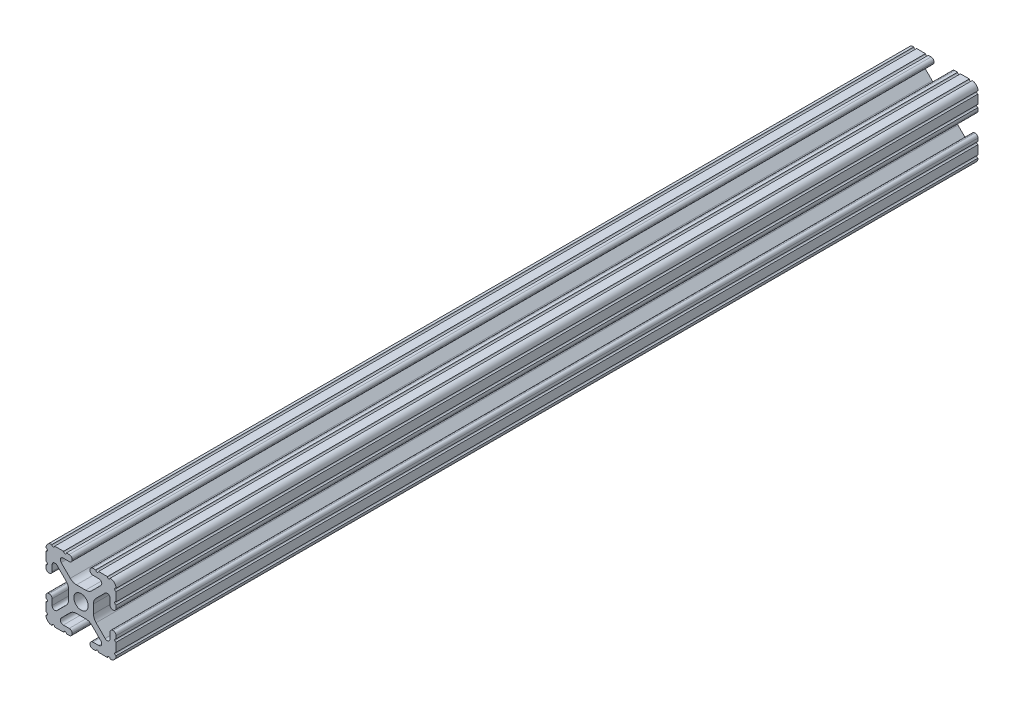
from build123d import *

# Parameters (mm, degrees)
SKETCH1_R               = 2.6035
BOSS_EXTRUDE1_DEPTH     = 457.2
CUT_EXTRUDE2_DEPTH      = 4.318
CUT_EXTRUDE2_DEPTH_BACK = 26.924
CUT_EXTRUDE3_DEPTH      = 459.081095441
CUT_EXTRUDE3_DEPTH_BACK = 459.081095441
SKETCH4_W               = 350.778797989
SKETCH4_H               = 30.197320423


with BuildPart() as part:
    # Sketch1 → Boss-Extrude1 (new, symmetric)
    with BuildSketch(Plane.XY):
        with BuildLine():
            Line((-7.179650497, -8.645192506), (-3.952270251, -5.423690499))
            ThreePointArc((-3.952270251, -5.423690499), (-2.922936451, -4.736929036), (-1.709253557, -4.4958))
            Line((-1.709253557, -4.4958), (1.709253557, -4.4958))
            ThreePointArc((1.709253557, -4.4958), (2.922936451, -4.736929036), (3.952270251, -5.423690499))
            Line((3.952270251, -5.423690499), (7.179650497, -8.645192506))
            ThreePointArc((7.179650497, -8.645192506), (7.41473083, -9.822813117), (6.416408329, -10.4902))
            Line((6.416408329, -10.4902), (4.287512407, -10.4902))
            ThreePointArc((4.287512407, -10.4902), (3.54574862, -10.79744862), (3.2385, -11.539212407))
            Line((3.2385, -11.539212407), (3.2385, -11.650987593))
            ThreePointArc((3.2385, -11.650987593), (3.54574862, -12.39275138), (4.287512407, -12.7))
            Line((4.287512407, -12.7), (5.317126718, -12.7))
            ThreePointArc((5.317126718, -12.7), (5.825126718, -12.192), (6.333126718, -12.7))
            Line((6.333126718, -12.7), (9.550443118, -12.7))
            ThreePointArc((9.550443118, -12.7), (10.058366869, -12.192000006), (10.566443095, -12.699847501))
            ThreePointArc((10.566443095, -12.699847501), (12.082537762, -12.08250727), (12.699846982, -10.566399977))
            ThreePointArc((12.699846982, -10.566399977), (12.192000006, -10.058323491), (12.7, -9.5504))
            Line((12.7, -9.5504), (12.7, -6.3330836))
            ThreePointArc((12.7, -6.3330836), (12.192, -5.8250836), (12.7, -5.3170836))
            Line((12.7, -5.3170836), (12.7, -4.287469289))
            ThreePointArc((12.7, -4.287469289), (12.39275138, -3.545705502), (11.650987593, -3.238456882))
            Line((11.650987593, -3.238456882), (11.539212407, -3.238456882))
            ThreePointArc((11.539212407, -3.238456882), (10.79744862, -3.545705502), (10.4902, -4.287469289))
            Line((10.4902, -4.287469289), (10.4902, -6.402089023))
            ThreePointArc((10.4902, -6.402089023), (9.856505071, -7.351067942), (8.737131347, -7.129408934))
            Line((8.737131347, -7.129408934), (5.441005833, -3.840816462))
            ThreePointArc((5.441005833, -3.840816462), (4.750877967, -2.809883091), (4.5085, -1.593185507))
            Line((4.5085, -1.593185507), (4.5085, 1.593185507))
            ThreePointArc((4.5085, 1.593185507), (4.750877967, 2.809883091), (5.441005833, 3.840816462))
            Line((5.441005833, 3.840816462), (8.737131347, 7.129408934))
            ThreePointArc((8.737131347, 7.129408934), (9.856505071, 7.351067942), (10.4902, 6.402089023))
            Line((10.4902, 6.402089023), (10.4902, 4.287469289))
            ThreePointArc((10.4902, 4.287469289), (10.79744862, 3.545705502), (11.539212407, 3.238456882))
            Line((11.539212407, 3.238456882), (11.650987593, 3.238456882))
            ThreePointArc((11.650987593, 3.238456882), (12.39275138, 3.545705502), (12.7, 4.287469289))
            Line((12.7, 4.287469289), (12.7, 5.3170836))
            ThreePointArc((12.7, 5.3170836), (12.192, 5.8250836), (12.7, 6.3330836))
            Line((12.7, 6.3330836), (12.7, 9.5504))
            ThreePointArc((12.7, 9.5504), (12.192000006, 10.058323491), (12.699846982, 10.566399977))
            ThreePointArc((12.699846982, 10.566399977), (12.082537762, 12.08250727), (10.566443095, 12.699847501))
            ThreePointArc((10.566443095, 12.699847501), (10.058366869, 12.192000006), (9.550443118, 12.7))
            Line((9.550443118, 12.7), (6.333126718, 12.7))
            ThreePointArc((6.333126718, 12.7), (5.825126718, 12.192), (5.317126718, 12.7))
            Line((5.317126718, 12.7), (4.287512407, 12.7))
            ThreePointArc((4.287512407, 12.7), (3.54574862, 12.39275138), (3.2385, 11.650987593))
            Line((3.2385, 11.650987593), (3.2385, 11.539212407))
            ThreePointArc((3.2385, 11.539212407), (3.54574862, 10.79744862), (4.287512407, 10.4902))
            Line((4.287512407, 10.4902), (6.476788598, 10.4902))
            ThreePointArc((6.476788598, 10.4902), (7.432222385, 9.85140422), (7.207036008, 8.724370562))
            Line((7.207036008, 8.724370562), (3.898272566, 5.423169045))
            ThreePointArc((3.898272566, 5.423169045), (2.869120213, 4.736787962), (1.655778399, 4.4958))
            Line((1.655778399, 4.4958), (-1.655778399, 4.4958))
            ThreePointArc((-1.655778399, 4.4958), (-2.869120213, 4.736787962), (-3.898272566, 5.423169045))
            Line((-3.898272566, 5.423169045), (-7.207036008, 8.724370562))
            ThreePointArc((-7.207036008, 8.724370562), (-7.432222385, 9.85140422), (-6.476788598, 10.4902))
            Line((-6.476788598, 10.4902), (-4.287512407, 10.4902))
            ThreePointArc((-4.287512407, 10.4902), (-3.54574862, 10.79744862), (-3.2385, 11.539212407))
            Line((-3.2385, 11.539212407), (-3.2385, 11.650987593))
            ThreePointArc((-3.2385, 11.650987593), (-3.54574862, 12.39275138), (-4.287512407, 12.7))
            Line((-4.287512407, 12.7), (-5.317126718, 12.7))
            ThreePointArc((-5.317126718, 12.7), (-5.825126718, 12.192), (-6.333126718, 12.7))
            Line((-6.333126718, 12.7), (-9.550443118, 12.7))
            ThreePointArc((-9.550443118, 12.7), (-10.058366869, 12.192000006), (-10.566443095, 12.699847501))
            ThreePointArc((-10.566443095, 12.699847501), (-12.082537762, 12.08250727), (-12.699846982, 10.566399977))
            ThreePointArc((-12.699846982, 10.566399977), (-12.192000006, 10.058323491), (-12.7, 9.5504))
            Line((-12.7, 9.5504), (-12.7, 6.3330836))
            ThreePointArc((-12.7, 6.3330836), (-12.192, 5.8250836), (-12.7, 5.3170836))
            Line((-12.7, 5.3170836), (-12.7, 4.287469289))
            ThreePointArc((-12.7, 4.287469289), (-12.39275138, 3.545705502), (-11.650987593, 3.238456882))
            Line((-11.650987593, 3.238456882), (-11.539212407, 3.238456882))
            ThreePointArc((-11.539212407, 3.238456882), (-10.79744862, 3.545705502), (-10.4902, 4.287469289))
            Line((-10.4902, 4.287469289), (-10.4902, 6.402089023))
            ThreePointArc((-10.4902, 6.402089023), (-9.856505071, 7.351067942), (-8.737131347, 7.129408934))
            Line((-8.737131347, 7.129408934), (-5.441005833, 3.840816462))
            ThreePointArc((-5.441005833, 3.840816462), (-4.750877967, 2.809883091), (-4.5085, 1.593185507))
            Line((-4.5085, 1.593185507), (-4.5085, -1.593185507))
            ThreePointArc((-4.5085, -1.593185507), (-4.750877967, -2.809883091), (-5.441005833, -3.840816462))
            Line((-5.441005833, -3.840816462), (-8.737131347, -7.129408934))
            ThreePointArc((-8.737131347, -7.129408934), (-9.856505071, -7.351067942), (-10.4902, -6.402089023))
            Line((-10.4902, -6.402089023), (-10.4902, -4.287469289))
            ThreePointArc((-10.4902, -4.287469289), (-10.79744862, -3.545705502), (-11.539212407, -3.238456882))
            Line((-11.539212407, -3.238456882), (-11.650987593, -3.238456882))
            ThreePointArc((-11.650987593, -3.238456882), (-12.39275138, -3.545705502), (-12.7, -4.287469289))
            Line((-12.7, -4.287469289), (-12.7, -5.3170836))
            ThreePointArc((-12.7, -5.3170836), (-12.192, -5.8250836), (-12.7, -6.3330836))
            Line((-12.7, -6.3330836), (-12.7, -9.5504))
            ThreePointArc((-12.7, -9.5504), (-12.192000006, -10.058323491), (-12.699846982, -10.566399977))
            ThreePointArc((-12.699846982, -10.566399977), (-12.082537762, -12.08250727), (-10.566443095, -12.699847501))
            ThreePointArc((-10.566443095, -12.699847501), (-10.058366869, -12.192000006), (-9.550443118, -12.7))
            Line((-9.550443118, -12.7), (-6.333126718, -12.7))
            ThreePointArc((-6.333126718, -12.7), (-5.825126718, -12.192), (-5.317126718, -12.7))
            Line((-5.317126718, -12.7), (-4.287512407, -12.7))
            ThreePointArc((-4.287512407, -12.7), (-3.54574862, -12.39275138), (-3.2385, -11.650987593))
            Line((-3.2385, -11.650987593), (-3.2385, -11.539212407))
            ThreePointArc((-3.2385, -11.539212407), (-3.54574862, -10.79744862), (-4.287512407, -10.4902))
            Line((-4.287512407, -10.4902), (-6.416408329, -10.4902))
            ThreePointArc((-6.416408329, -10.4902), (-7.41473083, -9.822813117), (-7.179650497, -8.645192506))
        make_face()
        Circle(SKETCH1_R, mode=Mode.SUBTRACT)
    extrude(amount=BOSS_EXTRUDE1_DEPTH, both=True)

    # Sketch3 → Cut-Extrude2 (cut, two sides: drawn at the far end of the back side and taken through both)
    with BuildSketch(Plane.ZY.offset(12.7).offset(-CUT_EXTRUDE2_DEPTH_BACK)):
        Polygon((-203.2, -27.552777595), (-203.2, 21.158109763), (-461.090893327, 21.158109763), (-461.090893327, -25.4), align=None)
    extrude(amount=CUT_EXTRUDE2_DEPTH + CUT_EXTRUDE2_DEPTH_BACK, mode=Mode.SUBTRACT)

    # Sketch4 → Cut-Extrude3 (cut, two sides: drawn at the far end of the back side and taken through both)
    with BuildSketch(Plane(origin=(12.7, 0, 0), x_dir=(0, 0, -1), z_dir=(1, 0, 0)).offset(-CUT_EXTRUDE3_DEPTH_BACK)):
        with Locations((30.578874225, -0.091464018)):
            Rectangle(SKETCH4_W, SKETCH4_H)
    extrude(amount=CUT_EXTRUDE3_DEPTH + CUT_EXTRUDE3_DEPTH_BACK, mode=Mode.SUBTRACT)


solid = part.part
